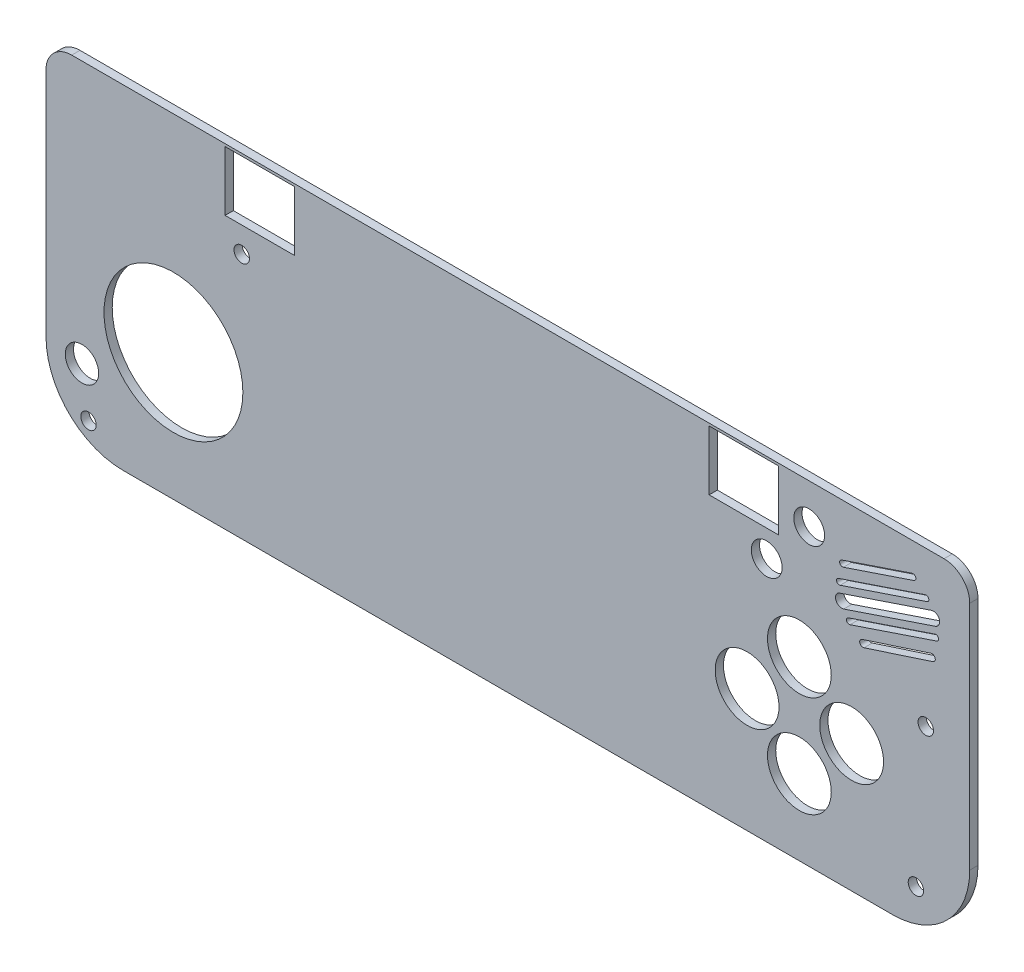
from build123d import *

# Parameters (mm, degrees)
BOSS_EXTRU_1_DEPTH       = 1.605097307
ESQUISSE22_R             = 13.5
ENL_V_MAT_EXTRU_1_DEPTH  = 2.5
ESQUISSE23_R             = 3.25
ENL_V_MAT_EXTRU_2_DEPTH  = 2.5
ESQUISSE24_W             = 13.5
ESQUISSE24_H             = 8.72
ENL_V_MAT_EXTRU_3_DEPTH  = 2.5
ESQUISSE25_W             = 13.5
ESQUISSE25_H             = 2.871774097
ENL_V_MAT_EXTRU_4_DEPTH  = 2.5
ESQUISSE26_R             = 6.2
ENL_V_MAT_EXTRU_5_DEPTH  = 2.5
ESQUISSE27_R             = 6.2
ENL_V_MAT_EXTRU_6_DEPTH  = 2.5
ESQUISSE30_W             = 13.5
ESQUISSE30_H             = 11.604300756
ENL_V_MAT_EXTRU_7_DEPTH  = 2.5
ESQUISSE31_R             = 3
ENL_V_MAT_EXTRU_8_DEPTH  = 2.5
ENL_V_MAT_EXTRU_9_DEPTH  = 2.5
ESQUISSE33_R             = 1.5
ENL_V_MAT_EXTRU_10_DEPTH = 10
ESQUISSE34_R             = 1.5
ENL_V_MAT_EXTRU_11_DEPTH = 10
ESQUISSE35_R             = 1.5
ENL_V_MAT_EXTRU_12_DEPTH = 10
ESQUISSE36_R             = 1.5
ENL_V_MAT_EXTRU_13_DEPTH = 10


with BuildPart() as part:
    # Esquisse20 → Boss.-Extru.1 (new body)
    with BuildSketch(Plane.XY):
        with BuildLine():
            Line((15, -2.2), (164.57, -2.2))
            ThreePointArc((164.57, -2.2), (175.176601718, 2.193398282), (179.57, 12.8))
            Line((179.57, 12.8), (179.57, 57.73))
            ThreePointArc((179.57, 57.73), (178.105533906, 61.265533906), (174.57, 62.73))
            Line((174.57, 62.73), (5, 62.73))
            ThreePointArc((5, 62.73), (1.464466094, 61.265533906), (0, 57.73))
            Line((0, 57.73), (0, 12.8))
            ThreePointArc((0, 12.8), (4.393398282, 2.193398282), (15, -2.2))
        make_face()
    extrude(amount=BOSS_EXTRU_1_DEPTH)

    # Esquisse22 → Enlèv. mat.-Extru.1 (cut)
    with BuildSketch(Plane.XY.offset(1.605097307)):
        with Locations((24.77, 22.57)):
            Circle(ESQUISSE22_R)
    extrude(amount=-ENL_V_MAT_EXTRU_1_DEPTH, mode=Mode.SUBTRACT)

    # Esquisse23 → Enlèv. mat.-Extru.2 (cut)
    with BuildSketch(Plane.XY.offset(1.605097307)):
        with Locations((6.99, 11.77)):
            Circle(ESQUISSE23_R)
        with Locations((-24.978214815, 23.569105699)):
            Circle(ESQUISSE23_R)
    extrude(amount=-ENL_V_MAT_EXTRU_2_DEPTH, mode=Mode.SUBTRACT)

    # Esquisse24 → Enlèv. mat.-Extru.3 (cut)
    with BuildSketch(Plane.XY.offset(1.605097307)):
        with Locations((41.57, 55.01)):
            Rectangle(ESQUISSE24_W, ESQUISSE24_H)
    extrude(amount=-ENL_V_MAT_EXTRU_3_DEPTH, mode=Mode.SUBTRACT)

    # Esquisse25 → Enlèv. mat.-Extru.4 (cut)
    with BuildSketch(Plane.XY.offset(1.605097307)):
        with Locations((41.57, 60.805887049)):
            Rectangle(ESQUISSE25_W, ESQUISSE25_H)
    extrude(amount=-ENL_V_MAT_EXTRU_4_DEPTH, mode=Mode.SUBTRACT)

    # Esquisse26 → Enlèv. mat.-Extru.5 (cut)
    with BuildSketch(Plane.XY.offset(1.605097307)):
        with Locations((156.61, 22.63)):
            Circle(ESQUISSE26_R)
    extrude(amount=-ENL_V_MAT_EXTRU_5_DEPTH, mode=Mode.SUBTRACT)

    # Esquisse27 → Enlèv. mat.-Extru.6 (cut)
    with BuildSketch(Plane.XY.offset(1.605097307)):
        with Locations((146.45, 12.47)):
            Circle(ESQUISSE27_R)
        with Locations((136.29, 21.73)):
            Circle(ESQUISSE27_R)
        with Locations((146.45, 32.15)):
            Circle(ESQUISSE27_R)
    extrude(amount=-ENL_V_MAT_EXTRU_6_DEPTH, mode=Mode.SUBTRACT)

    # Esquisse30 → Enlèv. mat.-Extru.7 (cut)
    with BuildSketch(Plane.XY.offset(1.605097307)):
        with Locations((135.66, 56.452150378)):
            Rectangle(ESQUISSE30_W, ESQUISSE30_H)
    extrude(amount=-ENL_V_MAT_EXTRU_7_DEPTH, mode=Mode.SUBTRACT)

    # Esquisse31 → Enlèv. mat.-Extru.8 (cut)
    with BuildSketch(Plane.XY.offset(1.605097307)):
        with Locations((148.36, 55.01)):
            Circle(ESQUISSE31_R)
        with Locations((140.1, 45.49)):
            Circle(ESQUISSE31_R)
    extrude(amount=-ENL_V_MAT_EXTRU_8_DEPTH, mode=Mode.SUBTRACT)

    # Esquisse32 → Enlèv. mat.-Extru.9 (cut)
    with BuildSketch(Plane.XY.offset(1.605097307)):
        with BuildLine():
            Line((172.894923492, 50.512296653), (155.078077531, 44.512296653))
            ThreePointArc((155.078077531, 44.512296653), (153.543873673, 45.273499488), (154.305076508, 46.807703347))
            Line((154.305076508, 46.807703347), (172.121922469, 52.807703347))
            ThreePointArc((172.121922469, 52.807703347), (173.656126327, 52.046500512), (172.894923492, 50.512296653))
        make_face()
        with BuildLine():
            Line((154.032116447, 49.1585259), (170.91722283, 54.844753334))
            ThreePointArc((170.91722283, 54.844753334), (171.583632283, 54.514110987), (171.252989936, 53.847701534))
            Line((171.252989936, 53.847701534), (154.367883553, 48.1614741))
            ThreePointArc((154.367883553, 48.1614741), (153.7014741, 48.492116447), (154.032116447, 49.1585259))
        make_face()
        with BuildLine():
            Line((154.651210294, 52.560335469), (168.366430681, 57.179072281))
            ThreePointArc((168.366430681, 57.179072281), (169.066193017, 56.831881736), (168.719002472, 56.1321194))
            Line((168.719002472, 56.1321194), (155.003782085, 51.513382588))
            ThreePointArc((155.003782085, 51.513382588), (154.304019749, 51.860573133), (154.651210294, 52.560335469))
        make_face()
        with BuildLine():
            Line((155.946794482, 43.472938631), (172.831900865, 49.159166065))
            ThreePointArc((172.831900865, 49.159166065), (173.499166065, 48.828099135), (173.168099135, 48.160833935))
            Line((173.168099135, 48.160833935), (156.282992752, 42.474606501))
            ThreePointArc((156.282992752, 42.474606501), (155.615727552, 42.805673431), (155.946794482, 43.472938631))
        make_face()
        with BuildLine():
            Line((158.617948097, 41.177385778), (172.031220731, 45.541527018))
            ThreePointArc((172.031220731, 45.541527018), (172.838365554, 45.130670883), (172.427509419, 44.32352606))
            Line((172.427509419, 44.32352606), (159.014236784, 39.959384821))
            ThreePointArc((159.014236784, 39.959384821), (158.207091962, 40.370240956), (158.617948097, 41.177385778))
        make_face()
    extrude(amount=-ENL_V_MAT_EXTRU_9_DEPTH, mode=Mode.SUBTRACT)

    # Esquisse33 → Enlèv. mat.-Extru.10 (cut)
    with BuildSketch(Plane.XY.offset(1.605097307)):
        with Locations((38.04665377, 45.73428297)):
            Circle(ESQUISSE33_R)
    extrude(amount=-ENL_V_MAT_EXTRU_10_DEPTH, mode=Mode.SUBTRACT)

    # Esquisse34 → Enlèv. mat.-Extru.11 (cut)
    with BuildSketch(Plane.XY.offset(1.605097307)):
        with Locations((8.26, 2.79)):
            Circle(ESQUISSE34_R)
    extrude(amount=-ENL_V_MAT_EXTRU_11_DEPTH, mode=Mode.SUBTRACT)

    # Esquisse35 → Enlèv. mat.-Extru.12 (cut)
    with BuildSketch(Plane.XY.offset(1.605097307)):
        with Locations((169.11, 4.8)):
            Circle(ESQUISSE35_R)
    extrude(amount=-ENL_V_MAT_EXTRU_12_DEPTH, mode=Mode.SUBTRACT)

    # Esquisse36 → Enlèv. mat.-Extru.13 (cut)
    with BuildSketch(Plane.XY.offset(1.605097307)):
        with Locations((171.02, 32.73)):
            Circle(ESQUISSE36_R)
    extrude(amount=-ENL_V_MAT_EXTRU_13_DEPTH, mode=Mode.SUBTRACT)


solid = part.part
